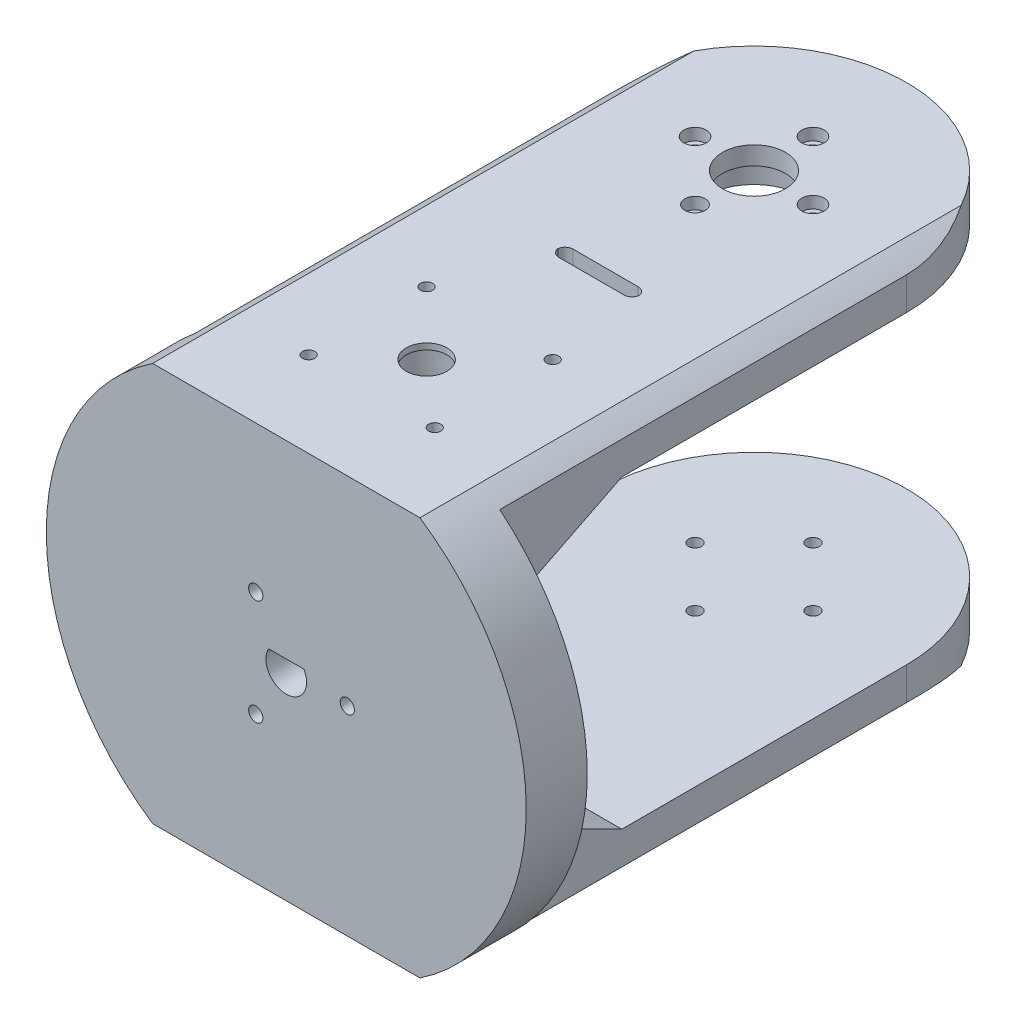
from build123d import *
from build123d.topology import SkipClean

# Parameters (mm, degrees)
SKETCH1_R                = 59
BASE_DEPTH               = 15
SKETCH2_R                = 20
TOPGROVE_DEPTH           = 2
BOSS_EXTRUDE3_START      = 100
BOSS_EXTRUDE3_DEPTH      = 100
SKETCH3_R                = 1.75
CUT_EXTRUDE2_DEPTH       = 13
BOSS_EXTRUDE4_REACH      = 152.974
BOSS_EXTRUDE4_END_RADIUS = 59
BOSS_EXTRUDE5_REACH      = 180.044
BOSS_EXTRUDE5_END_RADIUS = 59
CUT_EXTRUDE3_REACH       = 180.044
CUT_EXTRUDE3_END_RADIUS  = 59
SKETCH8_R                = 5
SKETCH8_R_2              = 1.5
SKETCH8_R_3              = 7.75
SKETCH9_R                = 8.5
CUT_EXTRUDE4_DEPTH       = 10
CUT_EXTRUDE5_DEPTH       = 184.655928408
CUT_EXTRUDE5_DEPTH_BACK  = 184.655928408
SKETCH10_W               = 137.5
SKETCH10_H               = 10
CUT_EXTRUDE6_DEPTH       = 161.836096817
CUT_EXTRUDE7_DEPTH       = 173.827949258
CUT_EXTRUDE7_DEPTH_BACK  = 173.827949258
SKETCH13_R               = 1.6
SKETCH14_W               = 175
SKETCH14_H               = 75
CUT_EXTRUDE8_DEPTH       = 184.655928411
SKETCH15_R               = 12.05
CUT_EXTRUDE9_DEPTH       = 7
SKETCH23_R               = 2.75
SKETCH23_R_2             = 2.5
CUT_EXTRUDE15_DEPTH      = 2.9
SKETCH16_W               = 20
SKETCH16_H               = 3.5
CUT_EXTRUDE10_DEPTH      = 11.5
FILLET4_R                = 2
SKETCH17_R               = 3.5
CUT_EXTRUDE11_DEPTH      = 4
SKETCH18_R               = 3
CUT_EXTRUDE12_DEPTH      = 3
SKETCH19_W               = 45
SKETCH19_H               = 60
CUT_EXTRUDE13_DEPTH      = 2
BOSS_EXTRUDE6_DEPTH      = 10
FILLET5_R                = 5
FILLET6_R                = 5
CUT_EXTRUDE14_DEPTH      = 3.5
MIRROR2_COPY_1_DEPTH     = 10


with BuildPart() as part:
    # Sketch1 → Base (new body)
    with BuildSketch(Plane.XY):
        Circle(SKETCH1_R)
        with BuildLine():
            Line((-4.330127019, 2.5), (4.330127019, 2.5))
            ThreePointArc((4.330127019, 2.5), (0, -5), (-4.330127019, 2.5))
        make_face(mode=Mode.SUBTRACT)
    extrude(amount=BASE_DEPTH)

    # Sketch2 → TopGrove (cut)
    with BuildSketch(Plane(origin=(0, 0, 0), x_dir=(-1, 0, 0), z_dir=(0, 0, -1))):
        Circle(SKETCH2_R)
    extrude(amount=-TOPGROVE_DEPTH, mode=Mode.SUBTRACT)

    # Sketch4 → Boss-Extrude3 (add)
    with SkipClean():  # the faces are left unmerged after this step: merging them gives an invalid solid
        with BuildSketch(Plane(origin=(0, 0, 0), x_dir=(-1, 0, 0), z_dir=(0, 0, -1)).offset(BOSS_EXTRUDE3_START)):
            with BuildLine():
                Line((-37.5, 37.5), (37.5, 37.5))
                Line((37.5, 37.5), (37.5, 45.549423707))
                ThreePointArc((37.5, 45.549423707), (0, 59), (-37.5, 45.549423707))
                Line((-37.5, 45.549423707), (-37.5, 37.5))
            make_face()
            with BuildLine():
                Line((-37.5, -37.5), (-37.5, -45.549423707))
                ThreePointArc((-37.5, -45.549423707), (0, -59), (37.5, -45.549423707))
                Line((37.5, -45.549423707), (37.5, -37.5))
                Line((37.5, -37.5), (-37.5, -37.5))
            make_face()
        extrude(amount=-BOSS_EXTRUDE3_DEPTH)

    # Sketch3 → Cut-Extrude2 (cut)
    with SkipClean():  # the faces are left unmerged after this step: merging them gives an invalid solid
        with BuildSketch(Plane(origin=(0, 0, 2), x_dir=(-1, 0, 0), z_dir=(0, 0, -1))):
            with Locations((-15, 0)):
                Circle(SKETCH3_R)
            with Locations((7.5, 12.990381057)):
                Circle(SKETCH3_R)
            with Locations((7.5, -12.990381057)):
                Circle(SKETCH3_R)
        extrude(amount=-CUT_EXTRUDE2_DEPTH, mode=Mode.SUBTRACT)

    # Boss-Extrude4: up to this cylinder (the profile starts inside it)
    with SkipClean():  # the faces are left unmerged after this step: merging them gives an invalid solid
        boss_extrude4_end = Plane(origin=(0, 0, -115.915494), z_dir=(0, 0, -1)) * Cylinder(BOSS_EXTRUDE4_END_RADIUS, 424.948, mode=Mode.PRIVATE)
        # Sketch6 → Boss-Extrude4 (add, up to the surface)
        with BuildSketch(Plane(origin=(0, -37.5, 0), x_dir=(1, 0, 0), z_dir=(0, 1, 0)), mode=Mode.PRIVATE) as boss_extrude4_sk1:
            with BuildLine():
                Line((37.5, 100), (-37.5, 100))
                ThreePointArc((-37.5, 100), (0, 137.5), (37.5, 100))
            make_face()
        boss_extrude4_tool1 = extrude(boss_extrude4_sk1.sketch, amount=-BOSS_EXTRUDE4_REACH, mode=Mode.PRIVATE) & boss_extrude4_end
        add(boss_extrude4_tool1.solids().sort_by_distance((0, -37.5, -115.915494))[0])

    # Boss-Extrude5: up to this cylinder (the profile starts inside it)
    with SkipClean():  # the faces are left unmerged after this step: merging them gives an invalid solid
        boss_extrude5_end = Plane(origin=(0, 0, -115.915494), z_dir=(0, 0, -1)) * Cylinder(BOSS_EXTRUDE5_END_RADIUS, 479.088, mode=Mode.PRIVATE)
        # Sketch7 → Boss-Extrude5 (add, up to the surface)
        with BuildSketch(Plane.XZ.offset(-37.5), mode=Mode.PRIVATE) as boss_extrude5_sk1:
            with BuildLine():
                Line((37.5, -100), (-37.5, -100))
                ThreePointArc((-37.5, -100), (0, -137.5), (37.5, -100))
            make_face()
        boss_extrude5_tool1 = extrude(boss_extrude5_sk1.sketch, amount=-BOSS_EXTRUDE5_REACH, mode=Mode.PRIVATE) & boss_extrude5_end
        add(boss_extrude5_tool1.solids().sort_by_distance((0, 37.5, -115.915494))[0])

    # Cut-Extrude3: up to this cylinder (the profile starts inside it)
    with SkipClean():  # the faces are left unmerged after this step: merging them gives an invalid solid
        cut_extrude3_end = Plane(origin=(0, 0, -53), z_dir=(0, 0, -1)) * Cylinder(CUT_EXTRUDE3_END_RADIUS, 573.088, mode=Mode.PRIVATE)
        # Sketch8 → Cut-Extrude3 (cut, up to the surface)
        with BuildSketch(Plane(origin=(0, 37.5, 0), x_dir=(-1, 0, 0), z_dir=(0, -1, 0)), mode=Mode.PRIVATE) as cut_extrude3_sk1:
            with Locations(Location((0, 19.5, 0), (0, 0, 90))):
                Circle(SKETCH8_R)
        cut_extrude3_tool1 = extrude(cut_extrude3_sk1.sketch, amount=-CUT_EXTRUDE3_REACH, mode=Mode.PRIVATE) & cut_extrude3_end
        add(cut_extrude3_tool1.solids().sort_by_distance((0, 37.5, -19.5))[0], mode=Mode.SUBTRACT)
        # Sketch8 → Cut-Extrude3 (cut, up to the surface)
        with BuildSketch(Plane(origin=(0, 37.5, 0), x_dir=(-1, 0, 0), z_dir=(0, -1, 0)), mode=Mode.PRIVATE) as cut_extrude3_sk2:
            with Locations(Location((15.5, 35, 0), (0, 0, 90))):
                Circle(SKETCH8_R_2)
        cut_extrude3_tool2 = extrude(cut_extrude3_sk2.sketch, amount=-CUT_EXTRUDE3_REACH, mode=Mode.PRIVATE) & cut_extrude3_end
        add(cut_extrude3_tool2.solids().sort_by_distance((-15.5, 37.5, -35))[0], mode=Mode.SUBTRACT)
        # Sketch8 → Cut-Extrude3 (cut, up to the surface)
        with BuildSketch(Plane(origin=(0, 37.5, 0), x_dir=(-1, 0, 0), z_dir=(0, -1, 0)), mode=Mode.PRIVATE) as cut_extrude3_sk3:
            with Locations(Location((-15.5, 35, 0), (0, 0, 90))):
                Circle(SKETCH8_R_2)
        cut_extrude3_tool3 = extrude(cut_extrude3_sk3.sketch, amount=-CUT_EXTRUDE3_REACH, mode=Mode.PRIVATE) & cut_extrude3_end
        add(cut_extrude3_tool3.solids().sort_by_distance((15.5, 37.5, -35))[0], mode=Mode.SUBTRACT)
        # Sketch8 → Cut-Extrude3 (cut, up to the surface)
        with BuildSketch(Plane(origin=(0, 37.5, 0), x_dir=(-1, 0, 0), z_dir=(0, -1, 0)), mode=Mode.PRIVATE) as cut_extrude3_sk4:
            with Locations(Location((-15.5, 6, 0), (0, 0, 90))):
                Circle(SKETCH8_R_2)
        cut_extrude3_tool4 = extrude(cut_extrude3_sk4.sketch, amount=-CUT_EXTRUDE3_REACH, mode=Mode.PRIVATE) & cut_extrude3_end
        add(cut_extrude3_tool4.solids().sort_by_distance((15.5, 37.5, -6))[0], mode=Mode.SUBTRACT)
        # Sketch8 → Cut-Extrude3 (cut, up to the surface)
        with BuildSketch(Plane(origin=(0, 37.5, 0), x_dir=(-1, 0, 0), z_dir=(0, -1, 0)), mode=Mode.PRIVATE) as cut_extrude3_sk5:
            with Locations(Location((15.5, 6, 0), (0, 0, 90))):
                Circle(SKETCH8_R_2)
        cut_extrude3_tool5 = extrude(cut_extrude3_sk5.sketch, amount=-CUT_EXTRUDE3_REACH, mode=Mode.PRIVATE) & cut_extrude3_end
        add(cut_extrude3_tool5.solids().sort_by_distance((-15.5, 37.5, -6))[0], mode=Mode.SUBTRACT)
        # Sketch8 → Cut-Extrude3 (cut, up to the surface)
        with BuildSketch(Plane(origin=(0, 37.5, 0), x_dir=(-1, 0, 0), z_dir=(0, -1, 0)), mode=Mode.PRIVATE) as cut_extrude3_sk6:
            with Locations(Location((0, 100, 0), (0, 0, 90))):
                Circle(SKETCH8_R_3)
        cut_extrude3_tool6 = extrude(cut_extrude3_sk6.sketch, amount=-CUT_EXTRUDE3_REACH, mode=Mode.PRIVATE) & cut_extrude3_end
        add(cut_extrude3_tool6.solids().sort_by_distance((0, 37.5, -100))[0], mode=Mode.SUBTRACT)

    # Sketch9 → Cut-Extrude4 (cut)
    with SkipClean():  # the faces are left unmerged after this step: merging them gives an invalid solid
        with BuildSketch(Plane.XZ.offset(-37.5)):
            with Locations(Location((0, -19.5, 0), (0, 0, 270))):
                Circle(SKETCH9_R)
        extrude(amount=-CUT_EXTRUDE4_DEPTH, mode=Mode.SUBTRACT)

    # Sketch10 → Cut-Extrude5 (cut, two sides: drawn at the far end of the back side and taken through both)
    with BuildSketch(Plane.ZY.offset(47.5).offset(-CUT_EXTRUDE5_DEPTH_BACK)):
        with Locations((-68.75, 54)):
            Rectangle(SKETCH10_W, SKETCH10_H)
    extrude(amount=CUT_EXTRUDE5_DEPTH + CUT_EXTRUDE5_DEPTH_BACK, mode=Mode.SUBTRACT)

    # Sketch12 → Cut-Extrude6 (cut, through all)
    with SkipClean():  # the faces are left unmerged after this step: merging them gives an invalid solid
        with BuildSketch(Plane(origin=(0, 0, 0), x_dir=(-1, 0, 0), z_dir=(0, 0, -1))):
            with BuildLine():
                Line((-32.86335345, 49), (32.86335345, 49))
                ThreePointArc((32.86335345, 49), (0, 59), (-32.86335345, 49))
            make_face()
        extrude(amount=-CUT_EXTRUDE6_DEPTH, mode=Mode.SUBTRACT)

    # Sketch13 → Cut-Extrude7 (cut, two sides: drawn at the far end of the back side and taken through both)
    with SkipClean():  # the faces are left unmerged after this step: merging them gives an invalid solid
        with BuildSketch(Plane(origin=(0, -37.5, 0), x_dir=(1, 0, 0), z_dir=(0, 1, 0)).offset(-CUT_EXTRUDE7_DEPTH_BACK)):
            with Locations(Location((0, 114.5, 0), (0, 0, 270))):
                Circle(SKETCH13_R)
            with Locations(Location((14.5, 100, 0), (0, 0, 270))):
                Circle(SKETCH13_R)
            with Locations(Location((0, 85.5, 0), (0, 0, 270))):
                Circle(SKETCH13_R)
            with Locations(Location((-14.5, 100, 0), (0, 0, 270))):
                Circle(SKETCH13_R)
        extrude(amount=CUT_EXTRUDE7_DEPTH + CUT_EXTRUDE7_DEPTH_BACK, mode=Mode.SUBTRACT)

    # Sketch14 → Cut-Extrude8 (cut, through all)
    with SkipClean():  # the faces are left unmerged after this step: merging them gives an invalid solid
        with BuildSketch(Plane.ZY.offset(47.5)):
            with Locations((-62.5, -86.5)):
                Rectangle(SKETCH14_W, SKETCH14_H)
        extrude(amount=-CUT_EXTRUDE8_DEPTH, mode=Mode.SUBTRACT)

    # Sketch15 → Cut-Extrude9 (cut)
    with SkipClean():  # the faces are left unmerged after this step: merging them gives an invalid solid
        with BuildSketch(Plane.XZ.offset(-37.5)):
            with Locations(Location((0, -100, 0), (0, 0, 270))):
                Circle(SKETCH15_R)
        extrude(amount=-CUT_EXTRUDE9_DEPTH, mode=Mode.SUBTRACT)

    # Sketch23 → Cut-Extrude15 (cut)
    with SkipClean():  # the faces are left unmerged after this step: merging them gives an invalid solid
        with BuildSketch(Plane(origin=(0, 49, 0), x_dir=(1, 0, 0), z_dir=(0, 1, 0))):
            with Locations(Location((0, 114.5, 0), (0, 0, 180))):
                Circle(SKETCH23_R)
            with Locations(Location((-14.5, 100, 0), (0, 0, 180))):
                Circle(SKETCH23_R)
            with Locations(Location((14.5, 100, 0), (0, 0, 180))):
                Circle(SKETCH23_R)
            with Locations(Location((0, 85.5, 0), (0, 0, 180))):
                Circle(SKETCH23_R_2)
        extrude(amount=-CUT_EXTRUDE15_DEPTH, mode=Mode.SUBTRACT)

    # Sketch16 → Cut-Extrude10 (cut)
    with SkipClean():  # the faces are left unmerged after this step: merging them gives an invalid solid
        with BuildSketch(Plane(origin=(0, 49, 0), x_dir=(1, 0, 0), z_dir=(0, 1, 0))):
            with Locations((2.5, 59.272909329)):
                Rectangle(SKETCH16_W, SKETCH16_H)
        extrude(amount=-CUT_EXTRUDE10_DEPTH, mode=Mode.SUBTRACT)

    # Fillet4
    # the kernel refuses this fillet: 2 mm, written as the material it adds along each edge
    with BuildSketch(Plane(origin=(12.5, 49, -61.022909329), x_dir=(-1, 0, 0), z_dir=(0, -1, 0)), Plane(origin=(12.5, 49, -57.522909329), x_dir=(0, 0, -1), z_dir=(0, -1, 0)), Plane(origin=(-7.5, 49, -57.522909329), x_dir=(1, 0, 0), z_dir=(0, -1, 0))) as fillet4_piece_1:
        with BuildLine():
            CenterArc((FILLET4_R, -FILLET4_R), FILLET4_R, 90, 90)
            Line((0, -FILLET4_R), (0, 0))
            Line((0, 0), (FILLET4_R, 0))
        make_face()
    extrude(amount=11.5)
    with BuildSketch(Plane(origin=(-7.5, 49, -61.022909329), x_dir=(1, 0, 0), z_dir=(0, -1, 0))) as fillet4_piece_2:
        with BuildLine():
            CenterArc((FILLET4_R, FILLET4_R), FILLET4_R, 180, 90)
            Line((0, FILLET4_R), (0, 0))
            Line((0, 0), (FILLET4_R, 0))
        make_face()
    extrude(amount=11.5)

    # Sketch17 → Cut-Extrude11 (cut)
    with BuildSketch(Plane(origin=(0, 0, 2), x_dir=(-1, 0, 0), z_dir=(0, 0, -1))):
        with Locations((7.5, 12.990381057)):
            Circle(SKETCH17_R)
        with Locations((7.5, -12.990381057)):
            Circle(SKETCH17_R)
        with Locations((-15, 0)):
            Circle(SKETCH17_R)
    extrude(amount=-CUT_EXTRUDE11_DEPTH, mode=Mode.SUBTRACT)

    # Sketch18 → Cut-Extrude12 (cut)
    with BuildSketch(Plane.XZ.offset(49)):
        with Locations((0, -114.5)):
            Circle(SKETCH18_R)
        with Locations((0, -85.5)):
            Circle(SKETCH18_R)
        with Locations((-14.5, -100)):
            Circle(SKETCH18_R)
        with Locations((14.5, -100)):
            Circle(SKETCH18_R)
    extrude(amount=-CUT_EXTRUDE12_DEPTH, mode=Mode.SUBTRACT)

    # Sketch19 → Cut-Extrude13 (cut)
    with BuildSketch(Plane(origin=(0, 0, 0), x_dir=(-1, 0, 0), z_dir=(0, 0, -1))):
        with Locations((0, 7.5)):
            Rectangle(SKETCH19_W, SKETCH19_H)
    extrude(amount=-CUT_EXTRUDE13_DEPTH, mode=Mode.SUBTRACT)

    # Sketch20 → Boss-Extrude6 (add)
    with BuildSketch(Plane(origin=(37.5, 0, 0), x_dir=(0, 0, -1), z_dir=(1, 0, 0))):
        Polygon((30, -37.5), (0, -37.5), (0, -22.5), align=None)
    boss_extrude6 = extrude(amount=-BOSS_EXTRUDE6_DEPTH)

    # Mirror1: Boss-Extrude6 across plane
    add(boss_extrude6.mirror(Plane(origin=(0, 0, 0), x_dir=(0, 0, 1), z_dir=(1, 0, 0))))

    # Fillet5
    fillet5_edges = [part.edges().sort_by_distance(p)[0] for p in [
        (0, -37.5, 0),
    ]]
    fillet(fillet5_edges, radius=FILLET5_R)

    # Fillet6
    fillet6_edges = [part.edges().sort_by_distance(p)[0] for p in [
        (30, 37.5, 0),
        (-30, 37.5, 0),
    ]]
    fillet(fillet6_edges, radius=FILLET6_R)

    # Sketch21 → Cut-Extrude14 (cut)
    with BuildSketch(Plane.XZ.offset(-37.5)):
        with BuildLine():
            Line((10.5, -54.522909329), (-5.5, -54.522909329))
            ThreePointArc((-5.5, -54.522909329), (-8.946012188, -55.900065142), (-10.493746089, -59.272909329))
            ThreePointArc((-10.493746089, -59.272909329), (-8.946012188, -62.645753515), (-5.5, -64.022909329))
            Line((-5.5, -64.022909329), (10.5, -64.022909329))
            ThreePointArc((10.5, -64.022909329), (13.946012188, -62.645753515), (15.493746089, -59.272909329))
            ThreePointArc((15.493746089, -59.272909329), (13.946012188, -55.900065142), (10.5, -54.522909329))
        make_face()
    extrude(amount=-CUT_EXTRUDE14_DEPTH, mode=Mode.SUBTRACT)

    # Mirror2: Boss-Extrude6 across plane
    add(boss_extrude6.mirror(Plane.ZX))

    # Mirror2 copy 1 sketch → Mirror2 copy 1 (add)
    with BuildSketch(Plane(origin=(-37.5, 0, 0), x_dir=(0, 0, -1), z_dir=(-1, 0, 0))):
        Polygon((30, -37.5), (0, -37.5), (0, -22.5), align=None)
    extrude(amount=-MIRROR2_COPY_1_DEPTH)


solid = part.part
